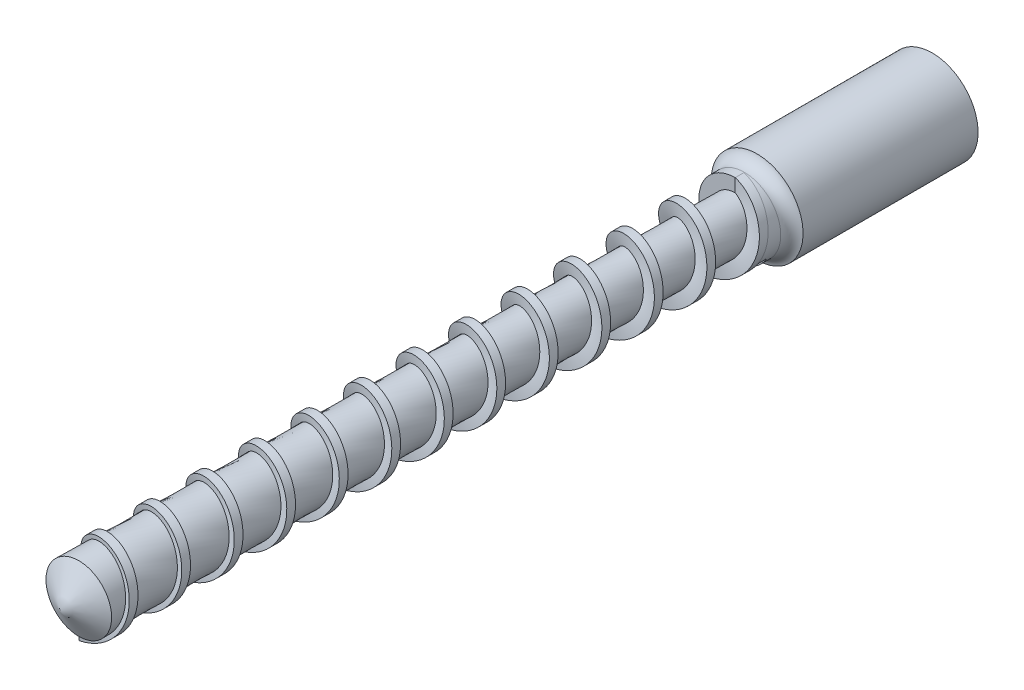
from build123d import *
from build123d.topology import SkipClean

# Parameters (mm, degrees)
SWEEP1_PITCH                         = 12
SWEEP1_HEIGHT                        = 150
SWEEP1_RADIUS                        = 8.3
SWEEP1_START_ANGLE                   = 90
SKETCH2_W                            = 2
SKETCH2_H                            = 5
BOSS_EXTRUDE1_DEPTH                  = 2
F_12_0_12_DURCHMESSER_BOHRUNG1_D     = 12
F_12_0_12_DURCHMESSER_BOHRUNG1_DEPTH = 30
F_12_0_12_DURCHMESSER_BOHRUNG1_TIP   = 3.605163714
SCHNITT_LINEAR_START                 = -30
SCHNITT_LINEAR_AUSTRAGEN1_DEPTH      = 30
VERRUNDUNG5_R                        = 3


with BuildPart() as part:
    # Sweep1: sweep along a helix
    with BuildLine() as sweep1_path:
        add(Helix(SWEEP1_PITCH, SWEEP1_HEIGHT, SWEEP1_RADIUS, center=(0, 0, 0), direction=(0, 0, 1), lefthand=True, mode=Mode.PRIVATE).rotate(Axis((0, 0, 0), (0, 0, 1)), SWEEP1_START_ANGLE))
    # Sketch2 → Sweep1 (sweep)
    with BuildSketch(Plane(origin=(0, 0, 0), x_dir=(0, 0, -1), z_dir=(1, 0, 0))):
        with Locations((1, 5.8)):
            Rectangle(SKETCH2_W, SKETCH2_H)
    sweep(path=sweep1_path.line, is_frenet=True)

    # Sketch4 → Revolve1 (revolve)
    with BuildSketch(Plane(origin=(0, 0, 0), x_dir=(0, 0, -1), z_dir=(1, 0, 0)), mode=Mode.PRIVATE) as revolve1_sk:
        Polygon((0, 5.3), (0, 8.3), (5, 8.3), (5, 10.5), (45, 10.5), (45, 0), (10, 0), (-154.330127019, 0), (-150, 7.5), align=None)
    revolve(revolve1_sk.sketch.rotate(Axis((0, 0, -10.894210845), (0, 0, 1)), 90), axis=Axis((0, 0, -10.894210845), (0, 0, 1)))

    # Sketch18 → Boss-Extrude1 (add)
    with SkipClean():  # the faces are left unmerged after this step: merging them gives an invalid solid
        with BuildSketch(Plane.XY):
            with BuildLine():
                Line((0, 0), (7.186459006, 4.152686716))
                ThreePointArc((7.186459006, 4.152686716), (8.29999942, 0.003102687), (7.189561693, -4.147312704))
                Line((7.189561693, -4.147312704), (0, 0))
            make_face()
        extrude(amount=BOSS_EXTRUDE1_DEPTH)

    # Ø12.0 (12) Durchmesser Bohrung1
    with Locations(Plane(origin=(0, 0, -45), x_dir=(-1, 0, 0), z_dir=(0, 0, -1))):
        with Locations((0, 0)):
            Hole(F_12_0_12_DURCHMESSER_BOHRUNG1_D / 2, depth=F_12_0_12_DURCHMESSER_BOHRUNG1_DEPTH)
            with Locations((0, 0, -(F_12_0_12_DURCHMESSER_BOHRUNG1_DEPTH + F_12_0_12_DURCHMESSER_BOHRUNG1_TIP / 2))):  # 118° drill point
                Cone(0, F_12_0_12_DURCHMESSER_BOHRUNG1_D / 2, F_12_0_12_DURCHMESSER_BOHRUNG1_TIP, mode=Mode.SUBTRACT)

    # Skizze1 → Schnitt-Linear austragen1 (cut)
    with SkipClean():  # the faces are left unmerged after this step: merging them gives an invalid solid
        with BuildSketch(Plane(origin=(0, 0, -45), x_dir=(-1, 0, 0), z_dir=(0, 0, -1)).offset(SCHNITT_LINEAR_START)):
            with BuildLine():
                Line((0, 7.8), (-2.05, 7.8))
                Line((-2.05, 7.8), (-2.05, 5.638927203))
                ThreePointArc((-2.05, 5.638927203), (0, 6), (2.05, 5.638927203))
                Line((2.05, 5.638927203), (2.05, 7.8))
                Line((2.05, 7.8), (0, 7.8))
            make_face()
        extrude(amount=SCHNITT_LINEAR_AUSTRAGEN1_DEPTH, mode=Mode.SUBTRACT)

    # Verrundung5
    # the kernel refuses this fillet: 3 mm, written as the material it adds along each edge
    with BuildSketch(Plane(origin=(0, 0, -5), x_dir=(-1, 0, 0), z_dir=(0, 1, 0))) as verrundung5_piece_1:
        with BuildLine():
            CenterArc((11.3, 2.891366459), VERRUNDUNG5_R, 180, 74.533990047)
            Line((10.5, 0), (10.484, -0.057827329))
            ThreePointArc((10.484, -0.057827329), (9.4, -0.06), (8.3, -0.06))
            Line((8.3, -0.06), (8.24, 0))
            Line((8.24, 0), (8.24, 2.891366459))
            Line((8.24, 2.891366459), (8.3, 2.891366459))
        make_face()
    revolve(axis=Axis((0, 0, -5), (0, 0, 1)))


solid = part.part
